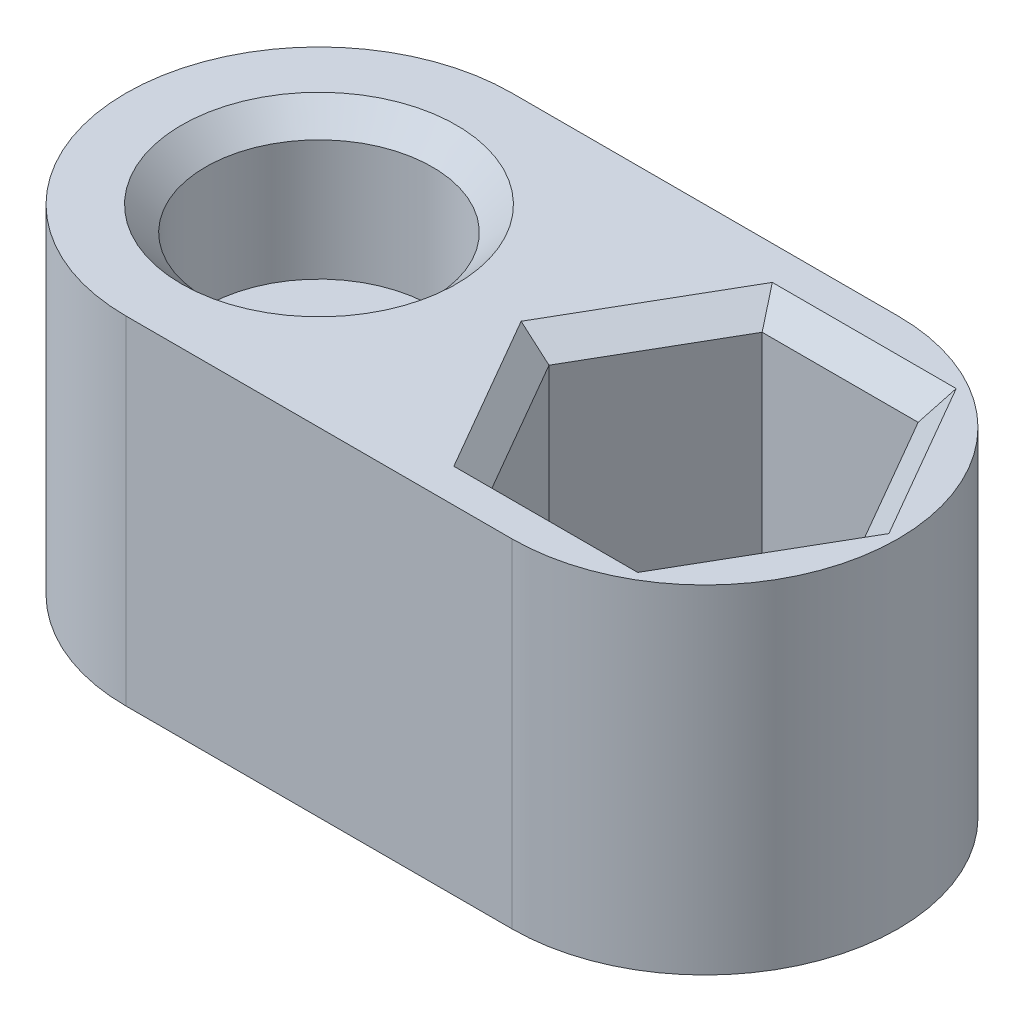
from build123d import *

# Parameters (mm, degrees)
BOSS_EXTRUDE1_DEPTH = 7
SKETCH2_R           = 2.35
CUT_EXTRUDE1_DEPTH  = 3
SKETCH3_R           = 2.75
CUT_EXTRUDE2_DEPTH  = 2.5
SKETCH4_R           = 1.3
CUT_EXTRUDE3_DEPTH  = 1
CUT_EXTRUDE4_DEPTH  = 6
SKETCH6_R           = 1.6
CUT_EXTRUDE5_DEPTH  = 11.770329614
CHAMFER1_SIZE       = 0.5


with BuildPart() as part:
    # Sketch1 → Boss-Extrude1 (new body)
    with BuildSketch(Plane(origin=(0, 0, 0), x_dir=(1, 0, 0), z_dir=(0, 1, 0))):
        with BuildLine():
            Line((-4, 4), (4, 4))
            ThreePointArc((4, 4), (8, 0), (4, -4))
            Line((4, -4), (-4, -4))
            ThreePointArc((-4, -4), (-8, 0), (-4, 4))
        make_face()
    extrude(amount=BOSS_EXTRUDE1_DEPTH)

    # Sketch2 → Cut-Extrude1 (cut)
    with BuildSketch(Plane(origin=(0, 7, 0), x_dir=(1, 0, 0), z_dir=(0, 1, 0))):
        with Locations((-4, 0)):
            Circle(SKETCH2_R)
    extrude(amount=-CUT_EXTRUDE1_DEPTH, mode=Mode.SUBTRACT)

    # Sketch3 → Cut-Extrude2 (cut)
    with BuildSketch(Plane.XZ):
        with Locations((-4, 0)):
            Circle(SKETCH3_R)
    extrude(amount=-CUT_EXTRUDE2_DEPTH, mode=Mode.SUBTRACT)

    # Sketch4 → Cut-Extrude3 (cut)
    with BuildSketch(Plane(origin=(0, 4, 0), x_dir=(1, 0, 0), z_dir=(0, 1, 0))):
        with Locations((-4, 0)):
            Circle(SKETCH4_R)
    extrude(amount=-CUT_EXTRUDE3_DEPTH, mode=Mode.SUBTRACT)

    # Sketch5 → Cut-Extrude4 (cut)
    with BuildSketch(Plane(origin=(0, 7, 0), x_dir=(1, 0, 0), z_dir=(0, 1, 0))):
        Polygon((7.233161507, 0), (5.616580754, 2.8), (2.383419246, 2.8), (0.766838493, 0), (2.383419246, -2.8), (5.616580754, -2.8), align=None)
    extrude(amount=-CUT_EXTRUDE4_DEPTH, mode=Mode.SUBTRACT)

    # Sketch6 → Cut-Extrude5 (cut, through all)
    with BuildSketch(Plane(origin=(0, 1, 0), x_dir=(1, 0, 0), z_dir=(0, 1, 0))):
        with Locations((4, 0)):
            Circle(SKETCH6_R)
    extrude(amount=-CUT_EXTRUDE5_DEPTH, mode=Mode.SUBTRACT)

    # Chamfer1
    chamfer1_edges = [part.edges().sort_by_distance(p)[0] for p in [
        (-6.35, 7, 0),
        (6.424871131, 7, -1.4),
        (6.424871131, 7, 1.4),
        (4, 7, 2.8),
        (1.575128869, 7, 1.4),
        (1.575128869, 7, -1.4),
        (4, 7, -2.8),
    ]]
    chamfer(chamfer1_edges, length=CHAMFER1_SIZE)


solid = part.part
